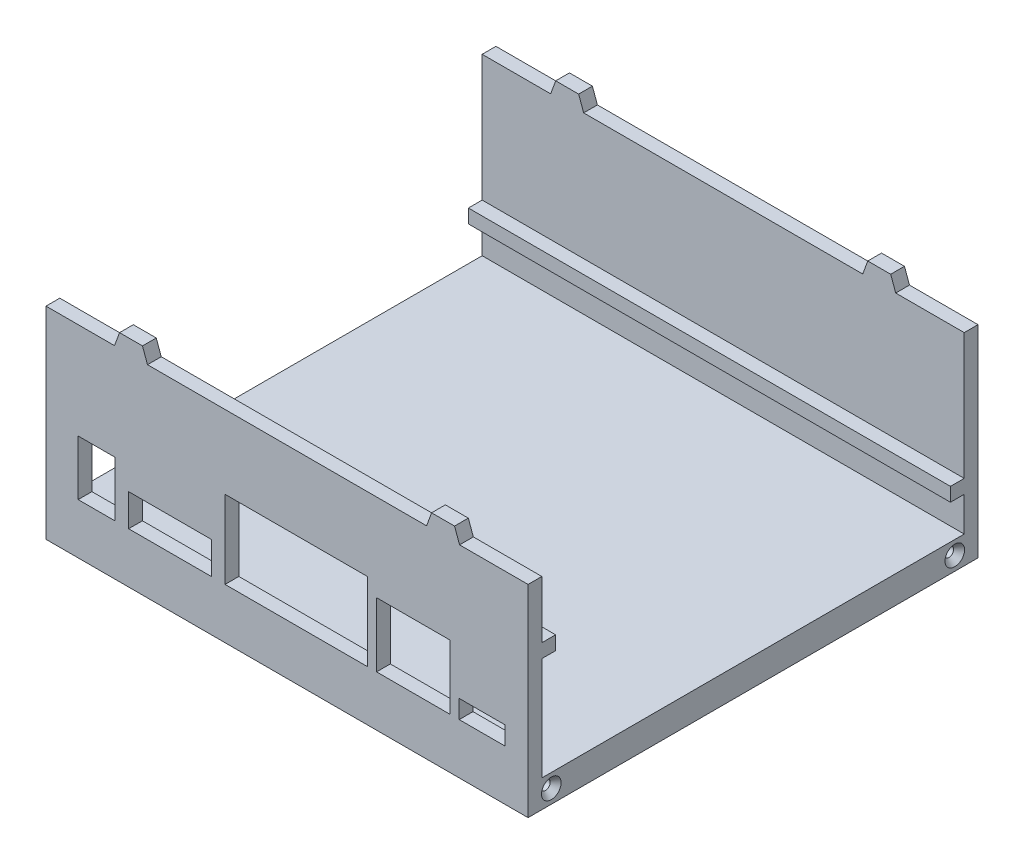
from build123d import *

# Parameters (mm, degrees)
SKETCH1_W               = 104
SKETCH1_H               = 92
BOSS_EXTRUDE1_DEPTH     = 38
SHELL1_T                = 6
SKETCH15_W              = 3
SKETCH15_H              = 44
CUT_EXTRUDE4_DEPTH      = 133.680066325
SKETCH3_W               = 8
SKETCH3_H               = 12
SKETCH3_W_2             = 18
SKETCH3_H_2             = 7
SKETCH3_W_3             = 16
SKETCH3_H_3             = 14
SKETCH3_W_4             = 31
SKETCH3_H_4             = 17
SKETCH3_W_5             = 10
SKETCH3_H_5             = 4
CUT_EXTRUDE2_DEPTH      = 10
CUT_EXTRUDE5_DEPTH      = 118.613774703
CUT_EXTRUDE5_DEPTH_BACK = 118.613774703
SKETCH3_3_W             = 5.5
SKETCH3_3_H             = 44
CUT_EXTRUDE3_DEPTH      = 122.512345052
CUT_EXTRUDE3_DEPTH_BACK = 122.512345052
BOSS_EXTRUDE2_DEPTH     = 3
BOSS_EXTRUDE3_START     = -3
BOSS_EXTRUDE3_OUTLINE_W = 105
BOSS_EXTRUDE3_OUTLINE_H = 3
BOSS_EXTRUDE3_DEPTH     = 3
BOSS_EXTRUDE4_START     = -3
BOSS_EXTRUDE4_OUTLINE_W = 105
BOSS_EXTRUDE4_OUTLINE_H = 3
BOSS_EXTRUDE4_DEPTH     = 3


# Read off the part's stored shape, not the designer's step: Boss-Extrude3, Boss-Extrude4
with BuildPart() as part:
    # Sketch1 → Boss-Extrude1 (new body)
    with BuildSketch(Plane(origin=(0, 0, 0), x_dir=(1, 0, 0), z_dir=(0, 1, 0))):
        Rectangle(SKETCH1_W, SKETCH1_H)
    extrude(amount=BOSS_EXTRUDE1_DEPTH)

    # Shell1
    shell1_openings = [part.faces().sort_by_distance(p)[0] for p in [
        (0, 38, 0),
    ]]
    offset(amount=SHELL1_T, openings=shell1_openings, kind=Kind.INTERSECTION)

    # Sketch15 → Cut-Extrude4 (cut, through all)
    with BuildSketch(Plane(origin=(58, 0, 0), x_dir=(0, 0, -1), z_dir=(1, 0, 0))):
        with Locations((-50.5, 16)):
            Rectangle(SKETCH15_W, SKETCH15_H)
        with Locations((50.5, 16)):
            Rectangle(SKETCH15_W, SKETCH15_H)
    extrude(amount=-CUT_EXTRUDE4_DEPTH, mode=Mode.SUBTRACT)

    # Sketch3 → Cut-Extrude2 (cut)
    with BuildSketch(Plane(origin=(0, 0, 46), x_dir=(-1, 0, 0), z_dir=(0, 0, -1))):
        with Locations((41.5, 11)):
            Rectangle(SKETCH3_W, SKETCH3_H)
        with Locations((25.5, 8.5)):
            Rectangle(SKETCH3_W_2, SKETCH3_H_2)
        with Locations((-27.5, 12)):
            Rectangle(SKETCH3_W_3, SKETCH3_H_3)
        with Locations((-2, 13.5)):
            Rectangle(SKETCH3_W_4, SKETCH3_H_4)
        with Locations((-42.5, 7)):
            Rectangle(SKETCH3_W_5, SKETCH3_H_5)
    extrude(amount=-CUT_EXTRUDE2_DEPTH, mode=Mode.SUBTRACT)

    # Sketch3<3> → Cut-Extrude5 (cut, two sides: drawn at the far end of the back side and taken through both)
    with BuildSketch(Plane(origin=(0, 0, 46), x_dir=(-1, 0, 0), z_dir=(0, 0, -1)).offset(-CUT_EXTRUDE5_DEPTH_BACK)):
        with Locations((55.25, 16)):
            Rectangle(SKETCH3_3_W, SKETCH3_3_H)
        with Locations((-55.25, 16)):
            Rectangle(SKETCH3_3_W, SKETCH3_3_H)
    extrude(amount=CUT_EXTRUDE5_DEPTH + CUT_EXTRUDE5_DEPTH_BACK, mode=Mode.SUBTRACT)

    # Sketch4 → Cut-Extrude3 (cut, two sides: drawn at the far end of the back side and taken through both)
    with BuildSketch(Plane(origin=(-52, 0, 0), x_dir=(0, 0, -1), z_dir=(1, 0, 0)).offset(-CUT_EXTRUDE3_DEPTH_BACK)):
        Polygon((-46, 257.389589044), (-46, 38), (-46, 0), (46, 0), (46, 38), (46, 257.389589044), (46, 696.168767132), (-46, 696.168767132), align=None)
    extrude(amount=CUT_EXTRUDE3_DEPTH + CUT_EXTRUDE3_DEPTH_BACK, mode=Mode.SUBTRACT)

    # Sketch10 → Boss-Extrude2 (add)
    with BuildSketch(Plane(origin=(0, 0, 46), x_dir=(-1, 0, 0), z_dir=(0, 0, -1))):
        Polygon((-37.576697733, 38), (-30.392876327, 38), (-31.48478703, 41), (-36.48478703, 41), align=None)
        Polygon((31.48478703, 41), (30.392876327, 38), (37.576697733, 38), (36.48478703, 41), align=None)
    boss_extrude2 = extrude(amount=-BOSS_EXTRUDE2_DEPTH)

    # Mirror3: Boss-Extrude2 across plane
    add(boss_extrude2.mirror(Plane.XY))

    # Boss-Extrude3 outline → Boss-Extrude3 (add)
    with BuildSketch(Plane(origin=(0, 0, -46), x_dir=(-1, 0, 0), z_dir=(0, 0, -1)).offset(BOSS_EXTRUDE3_START)):
        with Locations((0, 9)):
            Rectangle(BOSS_EXTRUDE3_OUTLINE_W, BOSS_EXTRUDE3_OUTLINE_H)
    extrude(amount=BOSS_EXTRUDE3_DEPTH)

    # Boss-Extrude4 outline → Boss-Extrude4 (add)
    with BuildSketch(Plane.XY.offset(46).offset(BOSS_EXTRUDE4_START)):
        with Locations((0, 24)):
            Rectangle(BOSS_EXTRUDE4_OUTLINE_W, BOSS_EXTRUDE4_OUTLINE_H)
    extrude(amount=BOSS_EXTRUDE4_DEPTH)

    # Sketch19 → CSK for #1 Flat Head Socket Cap Screw2 (revolve, cut)
    with BuildSketch(Plane(origin=(52.5, -3, 43.94), x_dir=(0, 0, -1), z_dir=(0, 1, 0))):
        Polygon((0, 0), (0, 35.618105319), (1.0287, 35), (1.0287, 1.271042053), (2.1336, 0), align=None)
    csk_for_1_flat_head_socket_cap_screw2 = revolve(axis=Axis((58.85, -3, 43.94), (-1, 0, 0)), mode=Mode.SUBTRACT)

    # Mirror4: CSK for #1 Flat Head Socket Cap Screw2 across plane
    add(csk_for_1_flat_head_socket_cap_screw2.mirror(Plane(origin=(0, 0, 0), x_dir=(0, 0, 1), z_dir=(1, 0, 0))), mode=Mode.SUBTRACT)

    # Mirror4 at the second plane: CSK for #1 Flat Head Socket Cap Screw2 across plane
    add(csk_for_1_flat_head_socket_cap_screw2.mirror(Plane.XY), mode=Mode.SUBTRACT)

    # Mirror4 at the second plane copy 1 sketc → Mirror4 at the second plane copy 1 (revolve, cut)
    with BuildSketch(Plane(origin=(-52.5, -3, -43.94), x_dir=(0, 0, 1), z_dir=(0, 1, 0))):
        Polygon((0, 0), (0, 35.618105319), (1.0287, 35), (1.0287, 1.271042053), (2.1336, 0), align=None)
    revolve(axis=Axis((-58.85, -3, -43.94), (1, 0, 0)), mode=Mode.SUBTRACT)


solid = part.part
